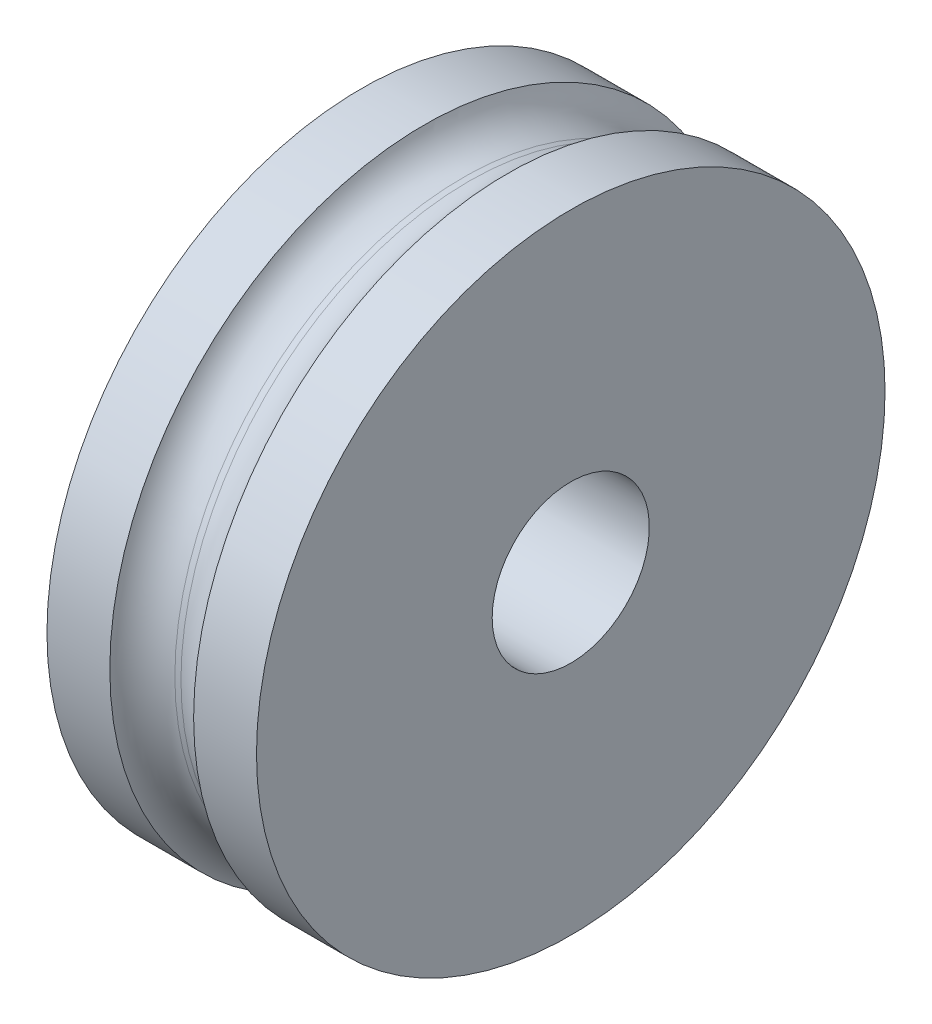
from build123d import *

# Parameters (mm, degrees)
FILLET1_R = 2.54


with BuildPart() as part:
    # Sketch1 → Revolve1 (revolve)
    with BuildSketch(Plane.XY, mode=Mode.PRIVATE) as revolve1_sk:
        Polygon((6.35, 4.7625), (-6.35, 4.7625), (-6.35, 19.05), (-2.54, 19.05), (-2.54, 17.4625), (2.54, 17.4625), (2.54, 19.05), (6.35, 19.05), align=None)
    revolve(revolve1_sk.sketch.rotate(Axis((-4.187009613, 0, 0), (1, 0, 0)), 90), axis=Axis((-4.187009613, 0, 0), (1, 0, 0)))

    # Fillet1
    # the kernel refuses this fillet: 2.54 mm, written as the material it adds along each edge
    with BuildSketch(Plane(origin=(-2.54, 0, 0), x_dir=(0, 0, 1), z_dir=(0, 1, 0))) as fillet1_piece_1:
        with BuildLine():
            CenterArc((20.0025, 2.35464302), FILLET1_R, 180, 67.975687163)
            Line((17.4625, 2.35464302), (17.4117, 2.35464302))
            Line((17.4117, 2.35464302), (17.4117, 0))
            Line((17.4117, 0), (17.4625, -0.0508))
            ThreePointArc((17.4625, -0.0508), (18.25625, -0.0508), (19.03095, -0.04709286))
            Line((19.03095, -0.04709286), (19.05, 0))
        make_face()
    revolve(axis=Axis((-2.54, 0, 0), (1, 0, 0)))
    with BuildSketch(Plane(origin=(2.54, 0, 0), x_dir=(0, 0, 1), z_dir=(0, 1, 0))) as fillet1_piece_2:
        with BuildLine():
            CenterArc((20.0025, -2.35464302), FILLET1_R, 112.024312837, 67.975687163)
            Line((19.05, 0), (19.03095, 0.04709286))
            ThreePointArc((19.03095, 0.04709286), (18.25625, 0.0508), (17.4625, 0.0508))
            Line((17.4625, 0.0508), (17.4117, 0))
            Line((17.4117, 0), (17.4117, -2.35464302))
            Line((17.4117, -2.35464302), (17.4625, -2.35464302))
        make_face()
    revolve(axis=Axis((2.54, 0, 0), (1, 0, 0)))


solid = part.part
